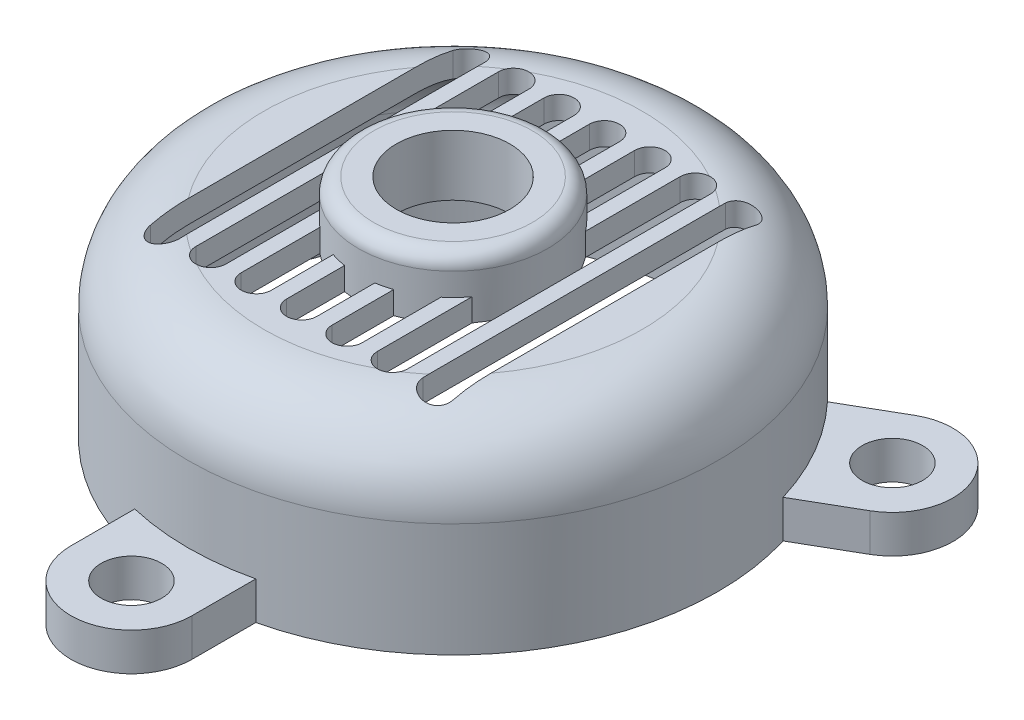
from build123d import *

# Parameters (mm, degrees)
SKETCH2_R           = 35
BOSS_EXTRUDE1_DEPTH = 25
FILLET1_R           = 10
SHELL1_T            = -3
SKETCH3_R           = 4
BOSS_EXTRUDE2_DEPTH = 5
CIRPATTERN1_COUNT   = 3
CUT_EXTRUDE1_DEPTH  = 72.991907702
SKETCH6_R           = 12.5
SKETCH6_R_2         = 7.5
BOSS_EXTRUDE3_DEPTH = 8
SKETCH7_R           = 7.5
CUT_EXTRUDE2_DEPTH  = 74.877160033
FILLET2_R           = 2


with BuildPart() as part:
    # Sketch2 → Boss-Extrude1 (new body)
    with BuildSketch(Plane(origin=(0, 0, 0), x_dir=(1, 0, 0), z_dir=(0, 1, 0))):
        Circle(SKETCH2_R)
    extrude(amount=BOSS_EXTRUDE1_DEPTH)

    # Fillet1
    fillet1_edges = [part.edges().sort_by_distance(p)[0] for p in [
        (-35, 25, 0),
    ]]
    fillet(fillet1_edges, radius=FILLET1_R)

    # Shell1
    shell1_openings = [part.faces().sort_by_distance(p)[0] for p in [
        (0, 0, 0),
    ]]
    offset(amount=SHELL1_T, openings=shell1_openings, kind=Kind.INTERSECTION)

    # Sketch3 → Boss-Extrude2 (add)
    with BuildSketch(Plane.XZ):
        with BuildLine():
            Line((-8, 34.073450075), (-8, 42.5))
            ThreePointArc((-8, 42.5), (0, 50.5), (8, 42.5))
            Line((8, 42.5), (8, 34.073450075))
            ThreePointArc((8, 34.073450075), (0, 35), (-8, 34.073450075))
        make_face()
        with Locations((0, 42.5)):
            Circle(SKETCH3_R, mode=Mode.SUBTRACT)
    boss_extrude2 = extrude(amount=-BOSS_EXTRUDE2_DEPTH)

    # CirPattern1: Boss-Extrude2 ×3 about axis
    cirpattern1_axis = Axis((0, 22, 0), (0, -1, 0))
    for i in range(1, CIRPATTERN1_COUNT):
        add(boss_extrude2.rotate(cirpattern1_axis, i * 360 / CIRPATTERN1_COUNT))

    # Sketch4 → Cut-Extrude1 (cut, through all)
    with BuildSketch(Plane(origin=(0, 25, 0), x_dir=(1, 0, 0), z_dir=(0, 1, 0))):
        with BuildLine():
            Line((2, 20), (2, -20))
            ThreePointArc((2, -20), (0, -22), (-2, -20))
            Line((-2, -20), (-2, 20))
            ThreePointArc((-2, 20), (0, 22), (2, 20))
        make_face()
        with BuildLine():
            Line((8, 20), (8, -20))
            ThreePointArc((8, -20), (6, -22), (4, -20))
            Line((4, -20), (4, 20))
            ThreePointArc((4, 20), (6, 22), (8, 20))
        make_face()
        with BuildLine():
            Line((14, 20), (14, -20))
            ThreePointArc((14, -20), (12, -22), (10, -20))
            Line((10, -20), (10, 20))
            ThreePointArc((10, 20), (12, 22), (14, 20))
        make_face()
        with BuildLine():
            Line((20, 20), (20, -20))
            ThreePointArc((20, -20), (18, -22), (16, -20))
            Line((16, -20), (16, 20))
            ThreePointArc((16, 20), (18, 22), (20, 20))
        make_face()
        with BuildLine():
            Line((-4, 20), (-4, -20))
            ThreePointArc((-4, -20), (-6, -22), (-8, -20))
            Line((-8, -20), (-8, 20))
            ThreePointArc((-8, 20), (-6, 22), (-4, 20))
        make_face()
        with BuildLine():
            Line((-10, 20), (-10, -20))
            ThreePointArc((-10, -20), (-12, -22), (-14, -20))
            Line((-14, -20), (-14, 20))
            ThreePointArc((-14, 20), (-12, 22), (-10, 20))
        make_face()
        with BuildLine():
            Line((-16, 20), (-16, -20))
            ThreePointArc((-16, -20), (-18, -22), (-20, -20))
            Line((-20, -20), (-20, 20))
            ThreePointArc((-20, 20), (-18, 22), (-16, 20))
        make_face()
    extrude(amount=-CUT_EXTRUDE1_DEPTH, mode=Mode.SUBTRACT)

    # Sketch6 → Boss-Extrude3 (add)
    with BuildSketch(Plane(origin=(0, 30, 0), x_dir=(1, 0, 0), z_dir=(0, 1, 0))):
        Circle(SKETCH6_R)
        Circle(SKETCH6_R_2, mode=Mode.SUBTRACT)
    extrude(amount=-BOSS_EXTRUDE3_DEPTH)

    # Sketch7 → Cut-Extrude2 (cut, through all)
    with BuildSketch(Plane(origin=(0, 30, 0), x_dir=(1, 0, 0), z_dir=(0, 1, 0))):
        Circle(SKETCH7_R)
    extrude(amount=-CUT_EXTRUDE2_DEPTH, mode=Mode.SUBTRACT)

    # Fillet2
    fillet2_edges = [part.edges().sort_by_distance(p)[0] for p in [
        (-12.5, 30, 0),
    ]]
    fillet(fillet2_edges, radius=FILLET2_R)


solid = part.part
